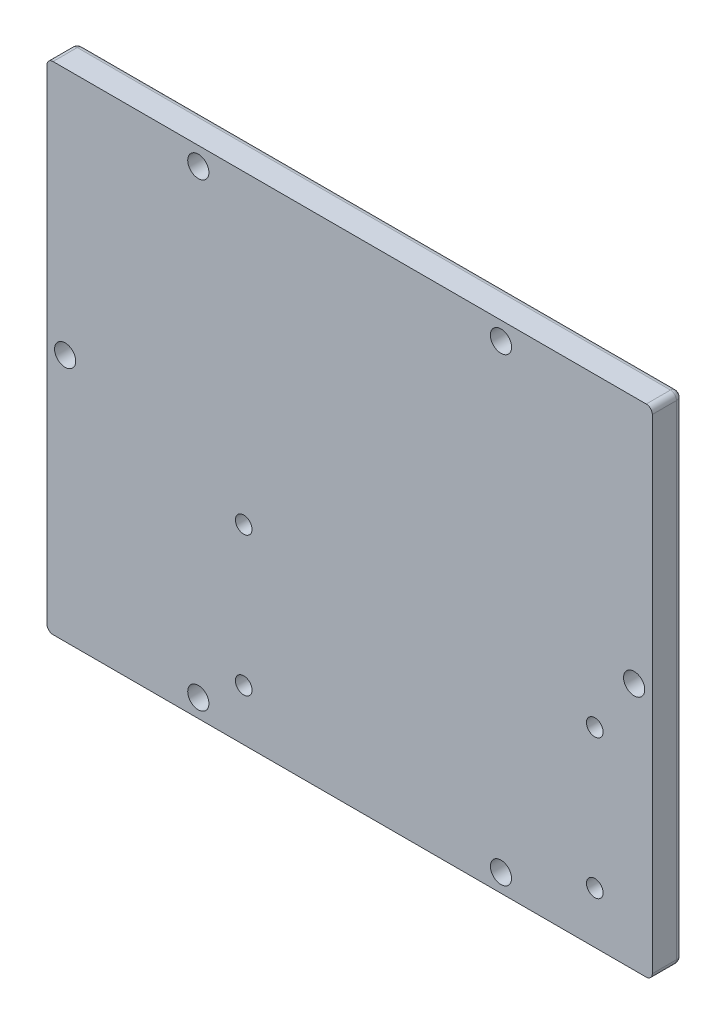
from build123d import *

# Parameters (mm, degrees)
ESQUISSE1_W             = 100
ESQUISSE1_H             = 82
BOSS_EXTRU_1_DEPTH      = 5
ESQUISSE2_R             = 1.75
ENL_V_MAT_EXTRU_1_DEPTH = 5
ESQUISSE3_R             = 1.75
ENL_V_MAT_EXTRU_2_DEPTH = 5
CONG_2_R                = 1
ESQUISSE8_R             = 1.375
ENL_V_MAT_EXTRU_6_DEPTH = 5


with BuildPart() as part:
    # Esquisse1 → Boss.-Extru.1 (new body)
    with BuildSketch(Plane.XY):
        Rectangle(ESQUISSE1_W, ESQUISSE1_H)
    extrude(amount=BOSS_EXTRU_1_DEPTH)

    # Esquisse2 → Enlèv. mat.-Extru.1 (cut)
    with BuildSketch(Plane.XY):
        with Locations(Location((-25, -38, 0), (0, 0, 180))):
            Circle(ESQUISSE2_R)
        with Locations(Location((25, -38, 0), (0, 0, 180))):
            Circle(ESQUISSE2_R)
        with Locations(Location((-25, 38, 0), (0, 0, 180))):
            Circle(ESQUISSE2_R)
        with Locations(Location((25, 38, 0), (0, 0, 180))):
            Circle(ESQUISSE2_R)
    extrude(amount=ENL_V_MAT_EXTRU_1_DEPTH, mode=Mode.SUBTRACT)

    # Esquisse3 → Enlèv. mat.-Extru.2 (cut)
    with BuildSketch(Plane.XY):
        with Locations(Location((47, 0, 0), (0, 0, 180))):
            Circle(ESQUISSE3_R)
    enl_v_mat_extru_2 = extrude(amount=ENL_V_MAT_EXTRU_2_DEPTH, mode=Mode.SUBTRACT)

    # Symétrie1: Enlèv. mat.-Extru.2 across plane
    add(enl_v_mat_extru_2.mirror(Plane(origin=(0, 0, 0), x_dir=(0, 0, 1), z_dir=(1, 0, 0))), mode=Mode.SUBTRACT)

    # Congé2
    # the kernel refuses this fillet: 1 mm, written as the material it takes off along each edge
    with BuildSketch(Plane(origin=(-49, -40, 1), x_dir=(-1, 0, 0), z_dir=(0, -1, 0))) as cong_2_piece_1_section:
        Polygon((0, 0), (CONG_2_R, 0), (CONG_2_R, CONG_2_R), (0, CONG_2_R), align=None)
    cong_2_piece_1 = extrude(amount=CONG_2_R, mode=Mode.PRIVATE)
    cong_2_piece_1 = cong_2_piece_1 - Plane(origin=(-49, -40, 1), x_dir=(0.7071067811865475, 0, 0.7071067811865475), z_dir=(0, -1, 0)) * Sphere(CONG_2_R, mode=Mode.PRIVATE)
    add(cong_2_piece_1, mode=Mode.SUBTRACT)
    with BuildSketch(Plane(origin=(49, -40, 1), x_dir=(1, 0, 0), z_dir=(0, -1, 0))) as cong_2_piece_2_section:
        Polygon((0, 0), (CONG_2_R, 0), (CONG_2_R, -CONG_2_R), (0, -CONG_2_R), align=None)
    cong_2_piece_2 = extrude(amount=CONG_2_R, mode=Mode.PRIVATE)
    cong_2_piece_2 = cong_2_piece_2 - Plane(origin=(49, -40, 1), x_dir=(-0.7071067811865475, 0, 0.7071067811865475), z_dir=(0, -1, 0)) * Sphere(CONG_2_R, mode=Mode.PRIVATE)
    add(cong_2_piece_2, mode=Mode.SUBTRACT)
    with BuildSketch(Plane(origin=(-49, 40, 1), x_dir=(0, 0, -1), z_dir=(-1, 0, 0))) as cong_2_piece_3_section:
        Polygon((0, 0), (CONG_2_R, 0), (CONG_2_R, -CONG_2_R), (0, -CONG_2_R), align=None)
    cong_2_piece_3 = extrude(amount=CONG_2_R, mode=Mode.PRIVATE)
    cong_2_piece_3 = cong_2_piece_3 - Plane(origin=(-49, 40, 1), x_dir=(0, -0.7071067811865475, 0.7071067811865475), z_dir=(-1, 0, 0)) * Sphere(CONG_2_R, mode=Mode.PRIVATE)
    add(cong_2_piece_3, mode=Mode.SUBTRACT)
    with BuildSketch(Plane(origin=(49, 40, 1), x_dir=(0, 0, -1), z_dir=(1, 0, 0))) as cong_2_piece_4_section:
        Polygon((0, 0), (CONG_2_R, 0), (CONG_2_R, CONG_2_R), (0, CONG_2_R), align=None)
    cong_2_piece_4 = extrude(amount=CONG_2_R, mode=Mode.PRIVATE)
    cong_2_piece_4 = cong_2_piece_4 - Plane(origin=(49, 40, 1), x_dir=(0, -0.7071067811865475, 0.7071067811865475), z_dir=(1, 0, 0)) * Sphere(CONG_2_R, mode=Mode.PRIVATE)
    add(cong_2_piece_4, mode=Mode.SUBTRACT)
    with BuildSketch(Plane(origin=(25, -38, 0), x_dir=(-1, 0, 0), z_dir=(0, 1, 0))) as cong_2_piece_5:
        with BuildLine():
            CenterArc((1.75 + CONG_2_R, CONG_2_R), CONG_2_R, 180, 90)
            Line((1.75, CONG_2_R), (1.75, 0))
            Line((1.75, 0), (1.75 + CONG_2_R, 0))
        make_face()
    revolve(axis=Axis((25, -38, 0), (0, 0, 1)), mode=Mode.SUBTRACT)
    with BuildSketch(Plane(origin=(-25, 38, 0), x_dir=(-1, 0, 0), z_dir=(0, 1, 0))) as cong_2_piece_6:
        with BuildLine():
            CenterArc((1.75 + CONG_2_R, CONG_2_R), CONG_2_R, 180, 90)
            Line((1.75, CONG_2_R), (1.75, 0))
            Line((1.75, 0), (1.75 + CONG_2_R, 0))
        make_face()
    revolve(axis=Axis((-25, 38, 0), (0, 0, 1)), mode=Mode.SUBTRACT)
    with BuildSketch(Plane(origin=(25, 38, 0), x_dir=(-1, 0, 0), z_dir=(0, 1, 0))) as cong_2_piece_7:
        with BuildLine():
            CenterArc((1.75 + CONG_2_R, CONG_2_R), CONG_2_R, 180, 90)
            Line((1.75, CONG_2_R), (1.75, 0))
            Line((1.75, 0), (1.75 + CONG_2_R, 0))
        make_face()
    revolve(axis=Axis((25, 38, 0), (0, 0, 1)), mode=Mode.SUBTRACT)
    with BuildSketch(Plane(origin=(-25, -38, 0), x_dir=(-1, 0, 0), z_dir=(0, 1, 0))) as cong_2_piece_8:
        with BuildLine():
            CenterArc((1.75 + CONG_2_R, CONG_2_R), CONG_2_R, 180, 90)
            Line((1.75, CONG_2_R), (1.75, 0))
            Line((1.75, 0), (1.75 + CONG_2_R, 0))
        make_face()
    revolve(axis=Axis((-25, -38, 0), (0, 0, 1)), mode=Mode.SUBTRACT)
    with BuildSketch(Plane(origin=(47, 0, 0), x_dir=(-1, 0, 0), z_dir=(0, 1, 0))) as cong_2_piece_9:
        with BuildLine():
            CenterArc((1.75 + CONG_2_R, CONG_2_R), CONG_2_R, 180, 90)
            Line((1.75, CONG_2_R), (1.75, 0))
            Line((1.75, 0), (1.75 + CONG_2_R, 0))
        make_face()
    revolve(axis=Axis((47, 0, 0), (0, 0, 1)), mode=Mode.SUBTRACT)
    with BuildSketch(Plane(origin=(-47, 0, 0), x_dir=(1, 0, 0), z_dir=(0, 1, 0))) as cong_2_piece_10:
        with BuildLine():
            CenterArc((1.75 + CONG_2_R, -CONG_2_R), CONG_2_R, 90, 90)
            Line((1.75, -CONG_2_R), (1.75, 0))
            Line((1.75, 0), (1.75 + CONG_2_R, 0))
        make_face()
    revolve(axis=Axis((-47, 0, 0), (0, 0, -1)), mode=Mode.SUBTRACT)
    with BuildSketch(Plane(origin=(-49, -41, 0), x_dir=(0, 0, 1), z_dir=(1, 0, 0))) as cong_2_piece_11:
        with BuildLine():
            CenterArc((CONG_2_R, -CONG_2_R), CONG_2_R, 90, 90)
            Line((0, -CONG_2_R), (0, 0))
            Line((0, 0), (CONG_2_R, 0))
        make_face()
    extrude(amount=98, mode=Mode.SUBTRACT)
    with BuildSketch(Plane(origin=(-50, 40, 0), x_dir=(0, 0, 1), z_dir=(0, -1, 0)), Plane(origin=(50, -40, 0), x_dir=(0, 0, 1), z_dir=(0, 1, 0))) as cong_2_piece_12:
        with BuildLine():
            CenterArc((CONG_2_R, -CONG_2_R), CONG_2_R, 90, 90)
            Line((0, -CONG_2_R), (0, 0))
            Line((0, 0), (CONG_2_R, 0))
        make_face()
    extrude(amount=80, mode=Mode.SUBTRACT)
    with BuildSketch(Plane(origin=(49, 41, 0), x_dir=(0, -1, 0), z_dir=(-1, 0, 0))) as cong_2_piece_13:
        with BuildLine():
            CenterArc((CONG_2_R, CONG_2_R), CONG_2_R, 180, 90)
            Line((0, CONG_2_R), (0, 0))
            Line((0, 0), (CONG_2_R, 0))
        make_face()
    extrude(amount=98, mode=Mode.SUBTRACT)
    with BuildSketch(Plane(origin=(50, -41, 1), x_dir=(-1, 0, 0), z_dir=(0, 0, 1)), Plane(origin=(50, 41, 1), x_dir=(0, -1, 0), z_dir=(0, 0, 1))) as cong_2_piece_14:
        with BuildLine():
            CenterArc((CONG_2_R, -CONG_2_R), CONG_2_R, 90, 90)
            Line((0, -CONG_2_R), (0, 0))
            Line((0, 0), (CONG_2_R, 0))
        make_face()
    extrude(amount=6.5, mode=Mode.SUBTRACT)
    with BuildSketch(Plane(origin=(-50, -41, 1), x_dir=(1, 0, 0), z_dir=(0, 0, 1)), Plane(origin=(-50, 41, 1), x_dir=(0, -1, 0), z_dir=(0, 0, 1))) as cong_2_piece_15:
        with BuildLine():
            CenterArc((CONG_2_R, CONG_2_R), CONG_2_R, 180, 90)
            Line((0, CONG_2_R), (0, 0))
            Line((0, 0), (CONG_2_R, 0))
        make_face()
    extrude(amount=6.5, mode=Mode.SUBTRACT)

    # Esquisse8 → Enlèv. mat.-Extru.6 (cut)
    with BuildSketch(Plane(origin=(0, 0, 0), x_dir=(-1, 0, 0), z_dir=(0, 0, -1))):
        with Locations((-40.5, -9.5)):
            Circle(ESQUISSE8_R)
        with Locations((17.5, -9.5)):
            Circle(ESQUISSE8_R)
        with Locations((17.5, -32.5)):
            Circle(ESQUISSE8_R)
        with Locations((-40.5, -32.5)):
            Circle(ESQUISSE8_R)
    extrude(amount=-ENL_V_MAT_EXTRU_6_DEPTH, mode=Mode.SUBTRACT)


solid = part.part
